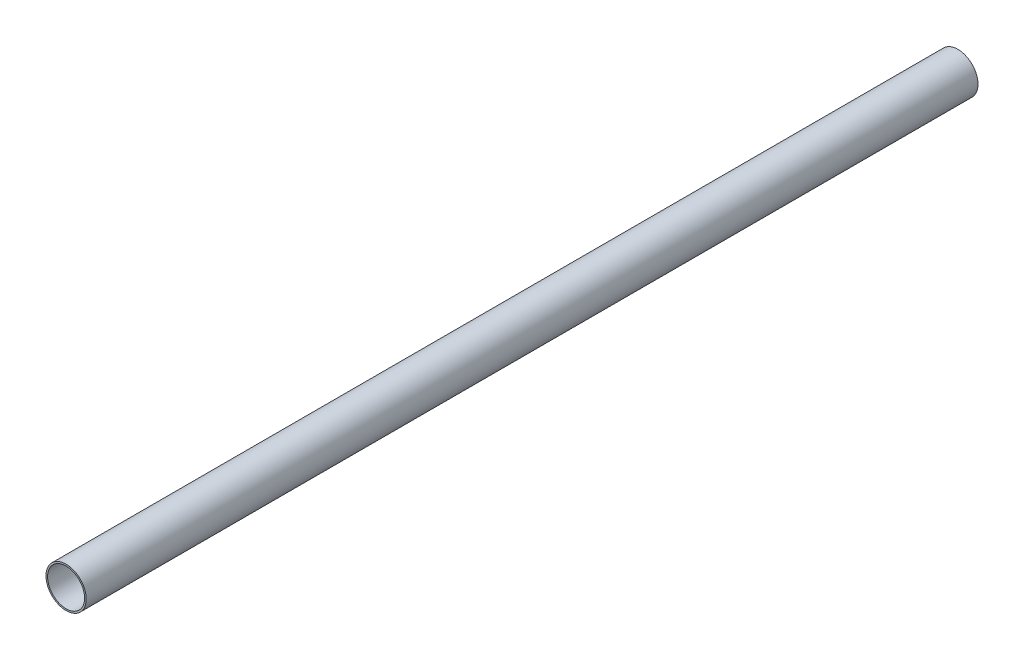
from build123d import *

# Parameters (mm, degrees)
SKETCH1_R           = 12.5
SKETCH1_R_2         = 11.5
BOSS_EXTRUDE1_DEPTH = 553.63


with BuildPart() as part:
    # Sketch1 → Boss-Extrude1 (new body)
    with BuildSketch(Plane.XY):
        Circle(SKETCH1_R)
        Circle(SKETCH1_R_2, mode=Mode.SUBTRACT)
    extrude(amount=BOSS_EXTRUDE1_DEPTH)


solid = part.part
